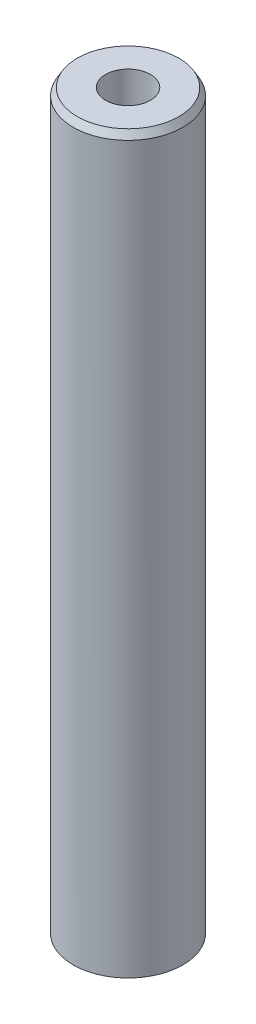
from build123d import *
from OCP.BRepFilletAPI import BRepFilletAPI_MakeChamfer

# Parameters (mm, degrees)
SKETCH1_R           = 37.5
BOSS_EXTRUDE1_DEPTH = 503.559410326
SKETCH2_R           = 15.345385249
CUT_EXTRUDE1_DEPTH  = 507.344329214
CHAMFER1_SIZE       = 4.894696649
CHAMFER1_SIZE2      = 2.825954428


with BuildPart() as part:
    # Sketch1 → Boss-Extrude1 (new body)
    with BuildSketch(Plane(origin=(0, 0, 0), x_dir=(1, 0, 0), z_dir=(0, 1, 0))):
        Circle(SKETCH1_R)
    extrude(amount=BOSS_EXTRUDE1_DEPTH)

    # Sketch2 → Cut-Extrude1 (cut, through all)
    with BuildSketch(Plane(origin=(0, 0, 0), x_dir=(1, 0, 0), z_dir=(0, 1, 0))):
        Circle(SKETCH2_R)
    extrude(amount=CUT_EXTRUDE1_DEPTH, mode=Mode.SUBTRACT)

    # Chamfer1: one chamfer whose edges measure the first distance from different faces: ONE call of the kernel's chamfer builder (chamfer() names one face for all edges)
    chamfer1_edges_1 = [part.edges().sort_by_distance(p)[0] for p in [
        (-37.5, 503.559410326, 0),
    ]]
    chamfer1_side_1 = [part.faces().sort_by_distance(p)[0] for p in [
        (-37.5, 251.779705163, 0),
    ]]
    chamfer1_edges_2 = [part.edges().sort_by_distance(p)[0] for p in [
        (-37.5, 0, 0),
    ]]
    chamfer1_side_2 = [part.faces().sort_by_distance(p)[0] for p in [
        (-36.439339828, 0, 0),
    ]]
    chamfer1 = BRepFilletAPI_MakeChamfer(part.part.solid().wrapped)
    for e in chamfer1_edges_1:
        chamfer1.Add(CHAMFER1_SIZE, CHAMFER1_SIZE2, e.wrapped, chamfer1_side_1[0].wrapped)  # the first distance lies on this face
    for e in chamfer1_edges_2:
        chamfer1.Add(CHAMFER1_SIZE, CHAMFER1_SIZE2, e.wrapped, chamfer1_side_2[0].wrapped)  # the first distance lies on this face
    add(Compound.cast(chamfer1.Shape()), mode=Mode.REPLACE)


solid = part.part
